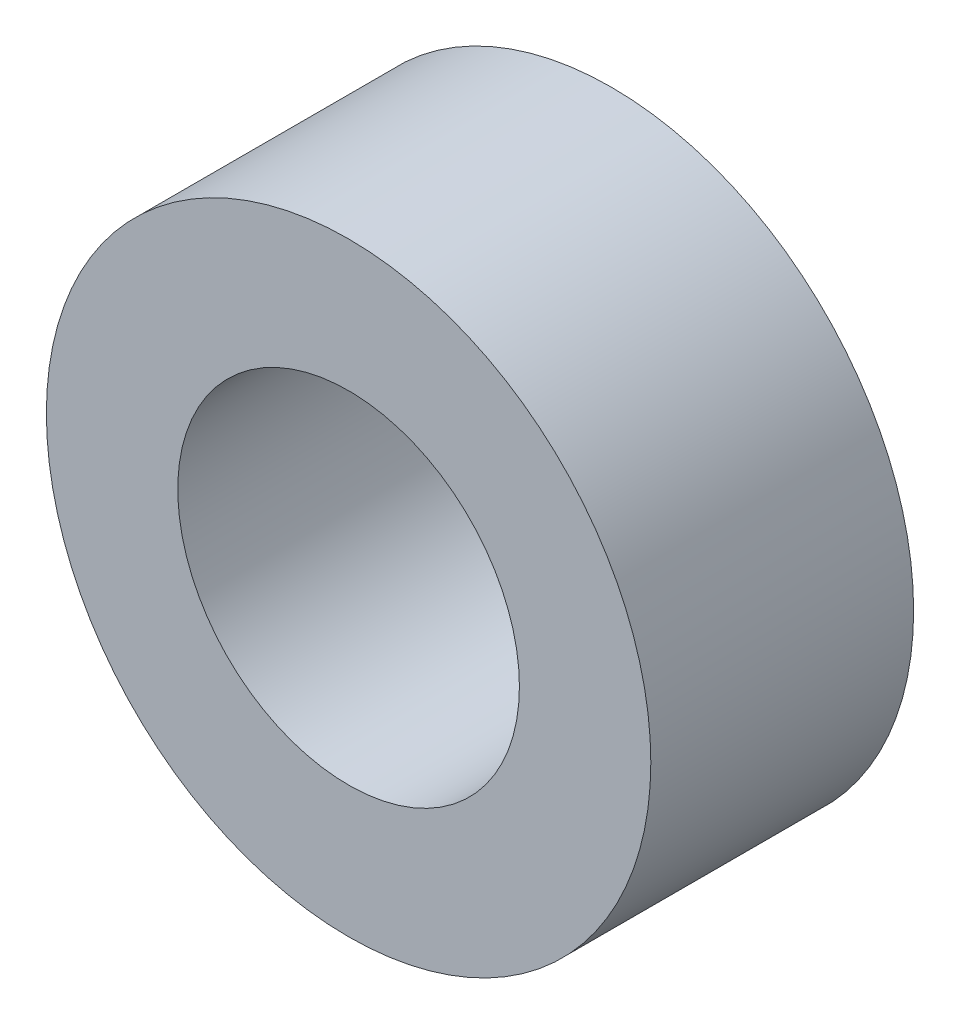
from build123d import *

# Parameters (mm, degrees)
SKETCH1_R           = 2.875
SKETCH1_R_2         = 1.625
BOSS_EXTRUDE1_DEPTH = 2.5


with BuildPart() as part:
    # Sketch1 → Boss-Extrude1 (new body)
    with BuildSketch(Plane.XY):
        Circle(SKETCH1_R)
        Circle(SKETCH1_R_2, mode=Mode.SUBTRACT)
    extrude(amount=BOSS_EXTRUDE1_DEPTH)


solid = part.part
